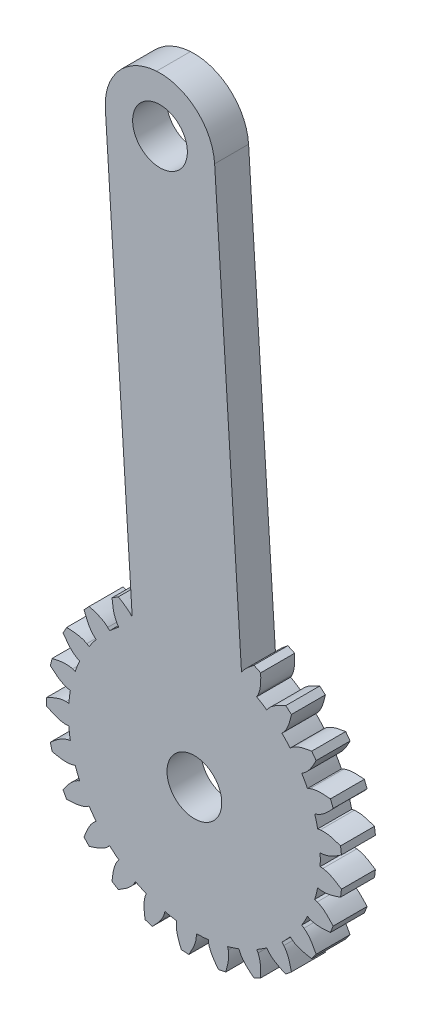
from build123d import *

# Parameters (mm, degrees)
BOSS_EXTRUDE2_DEPTH = 3.1
SKETCH4_R           = 11.496186131
SKETCH4_R_2         = 2.5
BOSS_EXTRUDE3_DEPTH = 3.1
CIRPATTERN1_COUNT   = 25
SKETCH6_R           = 2.5
BOSS_EXTRUDE6_DEPTH = 3.1
FILLET2_R           = 5


with BuildPart() as part:
    # Sketch2 → Boss-Extrude2 (new body)
    with BuildSketch(Plane.XY):
        with BuildLine():
            Line((0.175062763, 11.744853134), (0.175062763, 11.494853134))
            ThreePointArc((0.175062763, 11.494853134), (-0.7218515, 11.473501033), (-1.614369453, 11.382271602))
            Line((-1.614369453, 11.382271602), (-1.645702762, 11.630300277))
            add(Edge.make_bspline(
                [(-1.187283372, 13.447689697), (-1.331874499, 13.112761934), (-1.581548531, 12.513941733), (-1.662226172, 11.889865227), (-1.645702762, 11.630300277)],
                knots=[0.163671282, 0.163671282, 0.163671282, 0.163671282, 0.65433096, 1, 1, 1, 1], degree=3))
            Line((-1.187283372, 13.447689697), (-0.507521146, 13.490456712))
            add(Edge.make_bspline(
                [(-0.507521146, 13.490456712), (-0.322092583, 13.176292027), (0.000664766, 12.613486156), (0.158923767, 12.004442269), (0.175062763, 11.744853134)],
                knots=[0.163671282, 0.163671282, 0.163671282, 0.163671282, 0.65433096, 1, 1, 1, 1], degree=3))
        make_face()
    boss_extrude2 = extrude(amount=BOSS_EXTRUDE2_DEPTH)

    # Sketch4 → Boss-Extrude3 (add, through all)
    with BuildSketch(Plane.XY):
        Circle(SKETCH4_R)
        with Locations(Location((0, 0, 0), (0, 0, 180))):
            Circle(SKETCH4_R_2, mode=Mode.SUBTRACT)
    extrude(amount=BOSS_EXTRUDE3_DEPTH)

    # CirPattern1: Boss-Extrude2 ×25 about axis
    cirpattern1_axis = Axis((0, 0, 0), (0, 0, -1))
    for i in range(1, CIRPATTERN1_COUNT):
        add(boss_extrude2.rotate(cirpattern1_axis, i * 360 / CIRPATTERN1_COUNT))

    # Sketch6 → Boss-Extrude6 (add, through all)
    with BuildSketch(Plane.XY):
        Polygon((-5.280473982, 4.30087495), (-8.443612216, 54.577517466), (1.536655068, 55.205422661), (4.699793303, 4.928780145), align=None)
        with Locations(Location((-3.139525976, 49.901336421, 0), (0, 0, 180))):
            Circle(SKETCH6_R, mode=Mode.SUBTRACT)
    extrude(amount=BOSS_EXTRUDE6_DEPTH)

    # Fillet2
    fillet2_edges = [part.edges().sort_by_distance(p)[0] for p in [
        (-8.443612216, 54.577517466, 1.55),
        (1.536655068, 55.205422661, 1.55),
    ]]
    fillet(fillet2_edges, radius=FILLET2_R - 0.0001)  # a hair under: the kernel refuses the full size


solid = part.part
